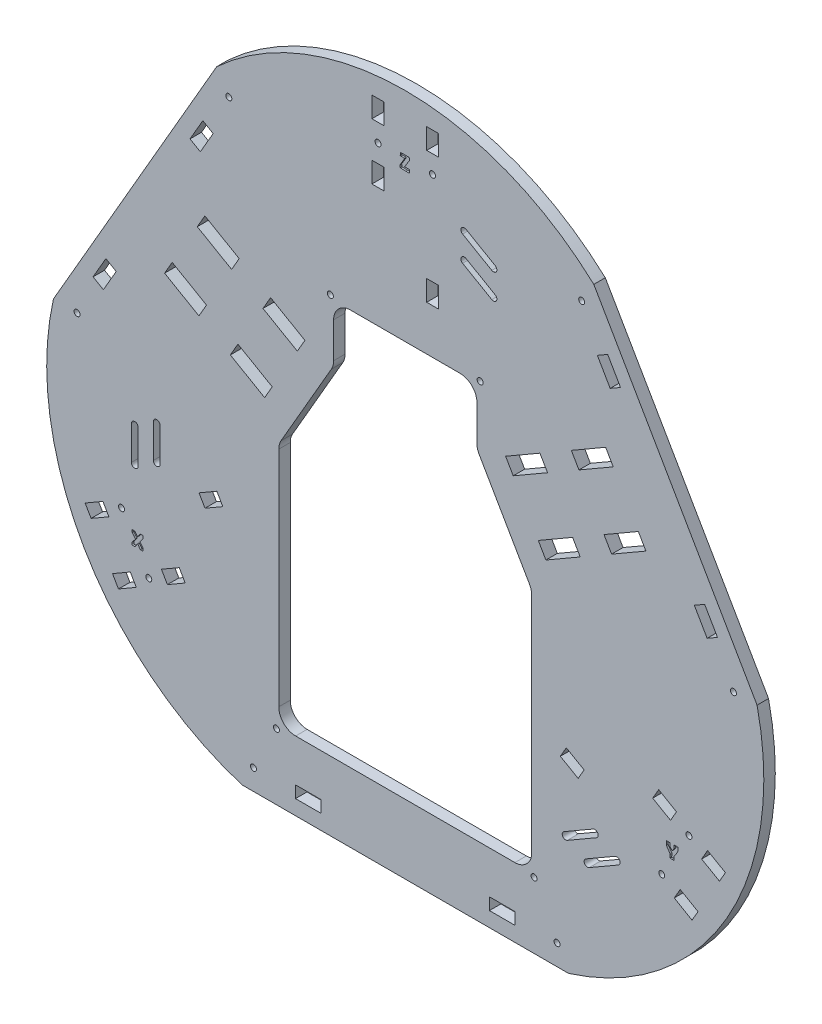
from build123d import *

# Parameters (mm, degrees)
SKETCH1_R                = 3.5
BOSS_EXTRUDE1_DEPTH      = 6.8
SKETCH2_R                = 1.775
SKETCH2_W                = 15.2
SKETCH2_H                = 7.08
CUT_EXTRUDE1_DEPTH       = 6.8
CIRPATTERN1_COUNT        = 3
SKETCH14_R               = 1.775
SKETCH14_W               = 7.08
SKETCH14_H               = 12.2
CUT_EXTRUDE12_DEPTH      = 307.036519191
CIRPATTERN2_COUNT        = 3
CUT_EXTRUDE10_DEPTH      = 1
CUT_EXTRUDE14_DEPTH      = 307.036519333
SKETCH17_R               = 1.775
CUT_EXTRUDE15_DEPTH      = 307.036519333
FILLET5_R                = 10
CUT_EXTRUDE16_DEPTH      = 12.5
LPATTERN1_COUNT          = 2
LPATTERN1_PITCH          = 45
CUT_EXTRUDE17_DEPTH      = 10
LPATTERN2_COUNT          = 2
LPATTERN2_PITCH          = 15
CIRPATTERN5_COPY_1_DEPTH = 10
CIRPATTERN5_COPY_2_DEPTH = 10
CIRPATTERN5_COPY_3_DEPTH = 10
CIRPATTERN5_COPY_4_DEPTH = 10
MIRROR6_COPY_1_DEPTH     = 12.5
MIRROR6_COPY_2_DEPTH     = 12.5


with BuildPart() as part:
    # Sketch1 → Boss-Extrude1 (new body)
    with BuildSketch(Plane.XY):
        with BuildLine():
            Line((-96.81218614, -185), (96.81218614, -185))
            ThreePointArc((96.81218614, -185), (190.525588833, -110), (208.62079277, 8.658187407))
            Line((208.62079277, 8.658187407), (111.80860663, 176.341812593))
            ThreePointArc((111.80860663, 176.341812593), (0, 220), (-111.80860663, 176.341812593))
            Line((-111.80860663, 176.341812593), (-208.62079277, 8.658187407))
            ThreePointArc((-208.62079277, 8.658187407), (-190.525588833, -110), (-96.81218614, -185))
        make_face()
        Circle(SKETCH1_R, mode=Mode.SUBTRACT)
    extrude(amount=BOSS_EXTRUDE1_DEPTH)

    # Sketch2 → Cut-Extrude1 (cut)
    with BuildSketch(Plane.XY.offset(6.8)):
        with Locations((-90, -172.76)):
            Circle(SKETCH2_R)
        with Locations((90, -172.76)):
            Circle(SKETCH2_R)
        with Locations((-57.5, -172.66)):
            Rectangle(SKETCH2_W, SKETCH2_H)
        with Locations((57.5, -172.66)):
            Rectangle(SKETCH2_W, SKETCH2_H)
    cut_extrude1 = extrude(amount=-CUT_EXTRUDE1_DEPTH, mode=Mode.SUBTRACT)

    # CirPattern1: Cut-Extrude1 ×3 about axis
    cirpattern1_axis = Axis((0, 0, 6.8), (0, 0, 1))
    for i in range(1, CIRPATTERN1_COUNT):
        add(cut_extrude1.rotate(cirpattern1_axis, i * 360 / CIRPATTERN1_COUNT), mode=Mode.SUBTRACT)

    # Sketch14 → Cut-Extrude12 (cut, through all)
    with BuildSketch(Plane.XY.offset(6.8)):
        with Locations((-16.14, 184.95)):
            Circle(SKETCH14_R)
        with Locations((16.14, 184.95)):
            Circle(SKETCH14_R)
        with Locations((-16.24, 201.7)):
            Rectangle(SKETCH14_W, SKETCH14_H)
        with Locations((-16.24, 168.2)):
            Rectangle(SKETCH14_W, SKETCH14_H)
        with Locations((16.24, 201.7)):
            Rectangle(SKETCH14_W, SKETCH14_H)
        with Locations((16.24, 123.7)):
            Rectangle(SKETCH14_W, SKETCH14_H)
    cut_extrude12 = extrude(amount=-CUT_EXTRUDE12_DEPTH, mode=Mode.SUBTRACT)

    # CirPattern2: Cut-Extrude12 ×3 about axis
    cirpattern2_axis = Axis((0, 0, 6.8), (0, 0, -1))
    for i in range(1, CIRPATTERN2_COUNT):
        add(cut_extrude12.rotate(cirpattern2_axis, i * 360 / CIRPATTERN2_COUNT), mode=Mode.SUBTRACT)

    # Sketch12 → Cut-Extrude10 (cut)
    with BuildSketch(Plane.XY.offset(6.8)):
        with BuildLine():
            Line((-157.066572257, -86.382099123), (-155.709655893, -86.382099123))
            add(Edge.make_bspline(
                [(-155.709655893, -86.382099123), (-155.536312863, -86.382099123), (-155.536312863, -86.488416698)],
                knots=[0, 0, 0, 1, 1, 1], degree=2))
            Line((-155.536312863, -86.488416698), (-155.536312863, -87.913173062))
            add(Edge.make_bspline(
                [(-155.536312863, -87.913173062), (-155.536312863, -88.050520941), (-157.368148015, -90.320038517), (-157.368148015, -90.364722153)],
                knots=[0, 0, 0, 1, 2, 2, 2], degree=2))
            add(Edge.make_bspline(
                [(-157.368148015, -90.364722153), (-157.368148015, -90.471039729), (-156.534557712, -91.524712456)],
                knots=[0, 0, 0, 1, 1, 1], degree=2))
            add(Edge.make_bspline(
                [(-156.534557712, -91.524712456), (-155.56361953, -92.736833668), (-155.536312863, -92.774070032)],
                knots=[0, 0, 0, 1, 1, 1], degree=2))
            add(Edge.make_bspline(
                [(-155.536312863, -92.774070032), (-155.442407409, -92.894040941), (-155.442407409, -93.608901547)],
                knots=[0, 0, 0, 1, 1, 1], degree=2))
            add(Edge.make_bspline(
                [(-155.442407409, -93.608901547), (-155.442407409, -94.124780335), (-155.475920136, -94.231097911)],
                knots=[0, 0, 0, 1, 1, 1], degree=2))
            add(Edge.make_bspline(
                [(-155.475920136, -94.231097911), (-155.558654681, -94.352310032), (-155.849486196, -94.352310032)],
                knots=[0, 0, 0, 1, 1, 1], degree=2))
            add(Edge.make_bspline(
                [(-155.849486196, -94.352310032), (-155.924773469, -94.352310032), (-156.079498318, -94.352310032)],
                knots=[0, 0, 0, 1, 1, 1], degree=2))
            add(Edge.make_bspline(
                [(-156.079498318, -94.352310032), (-156.272274075, -94.348586395), (-156.506009833, -94.348586395), (-156.926741954, -94.33369185), (-157.041748015, -94.33369185)],
                knots=[0, 0, 0, 1, 2, 3, 3, 3], degree=2))
            add(Edge.make_bspline(
                [(-157.041748015, -94.33369185), (-157.145583166, -94.33369185), (-158.687828015, -92.174215486), (-158.707687409, -92.17049185)],
                knots=[0, 0, 0, 1, 2, 2, 2], degree=2))
            add(Edge.make_bspline(
                [(-158.707687409, -92.17049185), (-158.830140742, -92.276809426), (-159.556172257, -93.354065183)],
                knots=[0, 0, 0, 1, 1, 1], degree=2))
            add(Edge.make_bspline(
                [(-159.556172257, -93.354065183), (-160.262344378, -94.359757305), (-160.33929953, -94.382099123)],
                knots=[0, 0, 0, 1, 1, 1], degree=2))
            add(Edge.make_bspline(
                [(-160.33929953, -94.382099123), (-160.431963772, -94.438768214), (-160.779464378, -94.438768214)],
                knots=[0, 0, 0, 1, 1, 1], degree=2))
            add(Edge.make_bspline(
                [(-160.779464378, -94.438768214), (-161.901403772, -94.438768214), (-161.901403772, -94.197585183), (-161.961796499, -93.738802153), (-161.961796499, -93.626278517)],
                knots=[0, 0, 0, 1, 2, 3, 3, 3], degree=2))
            add(Edge.make_bspline(
                [(-161.961796499, -93.626278517), (-161.961796499, -92.911417911), (-161.864167409, -92.787723365)],
                knots=[0, 0, 0, 1, 1, 1], degree=2))
            add(Edge.make_bspline(
                [(-161.864167409, -92.787723365), (-161.860443772, -92.783999729), (-160.879575893, -91.548295486)],
                knots=[0, 0, 0, 1, 1, 1], degree=2))
            add(Edge.make_bspline(
                [(-160.879575893, -91.548295486), (-160.062121348, -90.553774274), (-160.062121348, -90.375893062)],
                knots=[0, 0, 0, 1, 1, 1], degree=2))
            add(Edge.make_bspline(
                [(-160.062121348, -90.375893062), (-160.062121348, -90.241027608), (-160.875852257, -89.263883365)],
                knots=[0, 0, 0, 1, 1, 1], degree=2))
            add(Edge.make_bspline(
                [(-160.875852257, -89.263883365), (-161.371871651, -88.656581547), (-161.864167409, -88.046797305)],
                knots=[0, 0, 0, 1, 1, 1], degree=2))
            add(Edge.make_bspline(
                [(-161.864167409, -88.046797305), (-161.897680136, -87.957856698), (-161.905127409, -87.806855486)],
                knots=[0, 0, 0, 1, 1, 1], degree=2))
            add(Edge.make_bspline(
                [(-161.905127409, -87.806855486), (-161.908851045, -87.688125789), (-161.905127409, -87.473008214)],
                knots=[0, 0, 0, 1, 1, 1], degree=2))
            add(Edge.make_bspline(
                [(-161.905127409, -87.473008214), (-161.893956499, -87.273599729), (-161.893956499, -87.214448214)],
                knots=[0, 0, 0, 1, 1, 1], degree=2))
            add(Edge.make_bspline(
                [(-161.893956499, -87.214448214), (-161.893956499, -87.099442153), (-161.961796499, -86.667539123), (-161.961796499, -86.552533062)],
                knots=[0, 0, 0, 1, 2, 2, 2], degree=2))
            add(Edge.make_bspline(
                [(-161.961796499, -86.552533062), (-161.961796499, -86.441250638), (-161.75040256, -86.441250638)],
                knots=[0, 0, 0, 1, 1, 1], degree=2))
            add(Edge.make_bspline(
                [(-161.75040256, -86.441250638), (-161.626708015, -86.441250638), (-161.136894681, -86.463592456), (-161.016923772, -86.463592456)],
                knots=[0, 0, 0, 1, 2, 2, 2], degree=2))
            add(Edge.make_bspline(
                [(-161.016923772, -86.463592456), (-160.903158924, -86.463592456), (-160.456788015, -86.448697911), (-160.388521348, -86.448697911)],
                knots=[0, 0, 0, 1, 2, 2, 2], degree=2))
            add(Edge.make_bspline(
                [(-160.388521348, -86.448697911), (-160.284686196, -86.448697911), (-158.746164984, -88.611897911), (-158.722581954, -88.611897911)],
                knots=[0, 0, 0, 1, 2, 2, 2], degree=2))
            add(Edge.make_bspline(
                [(-158.722581954, -88.611897911), (-158.606334681, -88.525439729), (-157.879061954, -87.440736698)],
                knots=[0, 0, 0, 1, 1, 1], degree=2))
            add(Edge.make_bspline(
                [(-157.879061954, -87.440736698), (-157.175372257, -86.382099123), (-157.066572257, -86.382099123)],
                knots=[0, 0, 0, 1, 1, 1], degree=2))
        make_face()
        with BuildLine():
            Line((159.33519656, -87.81991), (159.46757959, -87.81991))
            add(Edge.make_bspline(
                [(159.46757959, -87.81991), (159.81135656, -87.81991), (161.144689893, -87.737175455), (161.492190499, -87.737175455)],
                knots=[0, 0, 0, 1, 2, 2, 2], degree=2))
            add(Edge.make_bspline(
                [(161.492190499, -87.737175455), (161.605955348, -87.737175455), (161.605955348, -88.022615455)],
                knots=[0, 0, 0, 1, 1, 1], degree=2))
            add(Edge.make_bspline(
                [(161.605955348, -88.022615455), (161.605955348, -88.303517273), (161.605955348, -89.513156061), (161.605955348, -89.797781515)],
                knots=[0, 0, 0, 1, 2, 2, 2], degree=2))
            add(Edge.make_bspline(
                [(161.605955348, -89.797781515), (161.605955348, -90.083221515), (161.504602621, -90.244152424)],
                knots=[0, 0, 0, 1, 1, 1], degree=2))
            add(Edge.make_bspline(
                [(161.504602621, -90.244152424), (160.766158984, -91.708627576), (159.463855954, -93.358431212)],
                knots=[0, 0, 0, 1, 1, 1], degree=2))
            add(Edge.make_bspline(
                [(159.463855954, -93.358431212), (159.302925045, -93.59837303), (159.302925045, -93.766751212)],
                knots=[0, 0, 0, 1, 1, 1], degree=2))
            add(Edge.make_bspline(
                [(159.302925045, -93.766751212), (159.302925045, -94.089427576), (159.424137166, -95.295342727), (159.424137166, -95.572520909)],
                knots=[0, 0, 0, 1, 2, 2, 2], degree=2))
            add(Edge.make_bspline(
                [(159.424137166, -95.572520909), (159.424137166, -95.681320909), (159.35257353, -95.696215455)],
                knots=[0, 0, 0, 1, 1, 1], degree=2))
            add(Edge.make_bspline(
                [(159.35257353, -95.696215455), (159.345126257, -95.699939091), (159.210260802, -95.714833636)],
                knots=[0, 0, 0, 1, 1, 1], degree=2))
            add(Edge.make_bspline(
                [(159.210260802, -95.714833636), (158.993902014, -95.737175455), (158.166517772, -95.737175455)],
                knots=[0, 0, 0, 1, 1, 1], degree=2))
            add(Edge.make_bspline(
                [(158.166517772, -95.737175455), (157.377184439, -95.737175455), (157.145931105, -95.714833636)],
                knots=[0, 0, 0, 1, 1, 1], degree=2))
            add(Edge.make_bspline(
                [(157.145931105, -95.714833636), (156.999894742, -95.699939091), (156.999894742, -95.565073636)],
                knots=[0, 0, 0, 1, 1, 1], degree=2))
            add(Edge.make_bspline(
                [(156.999894742, -95.565073636), (156.999894742, -95.242397273), (157.121106863, -94.017863939), (157.121106863, -93.733238485)],
                knots=[0, 0, 0, 1, 2, 2, 2], degree=2))
            add(Edge.make_bspline(
                [(157.121106863, -93.733238485), (157.121106863, -93.53053303), (156.945708075, -93.309209394)],
                knots=[0, 0, 0, 1, 1, 1], degree=2))
            add(Edge.make_bspline(
                [(156.945708075, -93.309209394), (156.229606257, -92.338271212), (154.947977166, -90.356676061)],
                knots=[0, 0, 0, 1, 1, 1], degree=2))
            add(Edge.make_bspline(
                [(154.947977166, -90.356676061), (154.81807656, -90.127905152), (154.81807656, -89.993039697)],
                knots=[0, 0, 0, 1, 1, 1], degree=2))
            add(Edge.make_bspline(
                [(154.81807656, -89.993039697), (154.81807656, -89.644297879), (154.81807656, -88.292346364), (154.81807656, -87.943604545)],
                knots=[0, 0, 0, 1, 2, 2, 2], degree=2))
            add(Edge.make_bspline(
                [(154.81807656, -87.943604545), (154.81807656, -87.737175455), (154.887584439, -87.737175455)],
                knots=[0, 0, 0, 1, 1, 1], degree=2))
            add(Edge.make_bspline(
                [(154.887584439, -87.737175455), (155.222672924, -87.737175455), (156.538629287, -87.816186364), (156.878682621, -87.816186364)],
                knots=[0, 0, 0, 1, 2, 2, 2], degree=2))
            add(Edge.make_bspline(
                [(156.878682621, -87.816186364), (156.999894742, -87.816186364), (156.999894742, -87.913815455)],
                knots=[0, 0, 0, 1, 1, 1], degree=2))
            add(Edge.make_bspline(
                [(156.999894742, -87.913815455), (156.999894742, -88.18727), (156.999894742, -89.367119697), (156.999894742, -89.640574242)],
                knots=[0, 0, 0, 1, 2, 2, 2], degree=2))
            add(Edge.make_bspline(
                [(156.999894742, -89.640574242), (156.999894742, -89.796540303), (157.510808681, -90.501471212)],
                knots=[0, 0, 0, 1, 1, 1], degree=2))
            add(Edge.make_bspline(
                [(157.510808681, -90.501471212), (157.910440196, -91.066571818), (158.212015954, -91.34375)],
                knots=[0, 0, 0, 1, 1, 1], degree=2))
            add(Edge.make_bspline(
                [(158.212015954, -91.34375), (158.463128681, -91.077742727), (158.865242621, -90.505194848)],
                knots=[0, 0, 0, 1, 1, 1], degree=2))
            add(Edge.make_bspline(
                [(158.865242621, -90.505194848), (159.424137166, -89.840797273), (159.424137166, -89.662916061)],
                knots=[0, 0, 0, 1, 1, 1], degree=2))
            add(Edge.make_bspline(
                [(159.424137166, -89.662916061), (159.424137166, -89.393185152), (159.302925045, -88.220782727), (159.302925045, -87.951051818)],
                knots=[0, 0, 0, 1, 2, 2, 2], degree=2))
            add(Edge.make_bspline(
                [(159.302925045, -87.951051818), (159.302925045, -87.831080909), (159.33519656, -87.81991)],
                knots=[0, 0, 0, 1, 1, 1], degree=2))
        make_face()
        with BuildLine():
            add(Edge.make_bspline(
                [(2.273089288, 178.670583363), (1.919382621, 178.670583363), (0.543848075, 178.730161545), (0.190141409, 178.730161545)],
                knots=[0, 0, 0, 1, 2, 2, 2], degree=2))
            add(Edge.make_bspline(
                [(0.190141409, 178.730161545), (-0.302154349, 178.730161545), (-2.266372531, 178.791795484), (-2.758668288, 178.791795484)],
                knots=[0, 0, 0, 1, 2, 2, 2], degree=2))
            add(Edge.make_bspline(
                [(-2.758668288, 178.791795484), (-2.981233137, 178.791795484), (-3.001092531, 178.917972454)],
                knots=[0, 0, 0, 1, 1, 1], degree=2))
            add(Edge.make_bspline(
                [(-3.001092531, 178.917972454), (-3.047831925, 179.280367605), (-3.092515561, 179.954694878)],
                knots=[0, 0, 0, 1, 1, 1], degree=2))
            add(Edge.make_bspline(
                [(-3.092515561, 179.954694878), (-3.122304652, 180.261235484), (-3.122304652, 180.283577302)],
                knots=[0, 0, 0, 1, 1, 1], degree=2))
            add(Edge.make_bspline(
                [(-3.122304652, 180.283577302), (-3.122304652, 180.302195484), (-0.414677985, 184.743601545), (-0.414677985, 184.894602757)],
                knots=[0, 0, 0, 1, 2, 2, 2], degree=2))
            add(Edge.make_bspline(
                [(-0.414677985, 184.894602757), (-0.414677985, 184.973613666), (-0.550784652, 184.973613666)],
                knots=[0, 0, 0, 1, 1, 1], degree=2))
            add(Edge.make_bspline(
                [(-0.550784652, 184.973613666), (-0.929315561, 184.973613666), (-2.497625864, 184.973613666), (-2.879880409, 184.973613666)],
                knots=[0, 0, 0, 1, 2, 2, 2], degree=2))
            add(Edge.make_bspline(
                [(-2.879880409, 184.973613666), (-3.001092531, 184.973613666), (-3.001092531, 185.099790636)],
                knots=[0, 0, 0, 1, 1, 1], degree=2))
            add(Edge.make_bspline(
                [(-3.001092531, 185.099790636), (-3.001092531, 185.276857302), (-2.758668288, 186.476566393), (-2.758668288, 186.735126393)],
                knots=[0, 0, 0, 1, 2, 2, 2], degree=2))
            add(Edge.make_bspline(
                [(-2.758668288, 186.735126393), (-2.758668288, 186.83647912), (-2.615114349, 186.83647912)],
                knots=[0, 0, 0, 1, 1, 1], degree=2))
            add(Edge.make_bspline(
                [(-2.615114349, 186.83647912), (-1.840675561, 186.83647912), (1.383644439, 186.791795484), (2.158083227, 186.791795484)],
                knots=[0, 0, 0, 1, 2, 2, 2], degree=2))
            add(Edge.make_bspline(
                [(2.158083227, 186.791795484), (2.279295348, 186.791795484), (2.343411712, 186.621361545)],
                knots=[0, 0, 0, 1, 1, 1], degree=2))
            add(Edge.make_bspline(
                [(2.343411712, 186.621361545), (2.453452924, 186.196905787), (2.453452924, 185.344697302)],
                knots=[0, 0, 0, 1, 1, 1], degree=2))
            add(Edge.make_bspline(
                [(2.453452924, 185.344697302), (2.453452924, 185.233414878), (2.345894136, 185.046845181)],
                knots=[0, 0, 0, 1, 1, 1], degree=2))
            add(Edge.make_bspline(
                [(2.345894136, 185.046845181), (1.992187469, 184.530966393), (0.883901409, 182.710302151)],
                knots=[0, 0, 0, 1, 1, 1], degree=2))
            add(Edge.make_bspline(
                [(0.883901409, 182.710302151), (-0.259386684, 180.879279185), (-0.392244222, 180.582489176)],
                knots=[0, 0, 0, 0.883793474, 0.883793474, 0.883793474], degree=2))
            add(Edge.make_bspline(
                [(-0.392244222, 180.582489176), (-0.36712338, 180.609977302), (-0.305877985, 180.609977302)],
                knots=[0.410167044, 0.410167044, 0.410167044, 1, 1, 1], degree=2))
            add(Edge.make_bspline(
                [(-0.305877985, 180.609977302), (0.809855348, 180.609977302), (1.417157166, 180.631077908)],
                knots=[0, 0, 0, 1, 1, 1], degree=2))
            add(Edge.make_bspline(
                [(1.417157166, 180.631077908), (1.538369288, 180.633560332), (1.976051712, 180.663349423)],
                knots=[0, 0, 0, 1, 1, 1], degree=2))
            add(Edge.make_bspline(
                [(1.976051712, 180.663349423), (2.289225045, 180.731189423), (2.482000803, 180.731189423)],
                knots=[0, 0, 0, 1, 1, 1], degree=2))
            add(Edge.make_bspline(
                [(2.482000803, 180.731189423), (2.574665045, 180.731189423), (2.574665045, 180.612459726)],
                knots=[0, 0, 0, 1, 1, 1], degree=2))
            add(Edge.make_bspline(
                [(2.574665045, 180.612459726), (2.574665045, 179.67999912), (2.453452924, 178.793036696)],
                knots=[0, 0, 0, 1, 1, 1], degree=2))
            add(Edge.make_bspline(
                [(2.453452924, 178.793036696), (2.396783833, 178.670583363), (2.273089288, 178.670583363)],
                knots=[0, 0, 0, 1, 1, 1], degree=2))
        make_face()
    extrude(amount=-CUT_EXTRUDE10_DEPTH, mode=Mode.SUBTRACT)

    # Sketch16 → Cut-Extrude14 (cut, through all)
    with BuildSketch(Plane.XY.offset(6.8)):
        Polygon((-75, 1), (-42.5, 57.291651246), (-42.5, 91), (42.5, 91), (42.5, 57.291651246), (75, 1), (75, -144), (-75, -144), align=None)
    extrude(amount=-CUT_EXTRUDE14_DEPTH, mode=Mode.SUBTRACT)

    # Sketch17 → Cut-Extrude15 (cut, through all)
    with BuildSketch(Plane.XY.offset(6.8)):
        with Locations((76.4, -145.9)):
            Circle(SKETCH17_R)
        with Locations((-76.4, -145.9)):
            Circle(SKETCH17_R)
        with Locations((-44.4, 92.9)):
            Circle(SKETCH17_R)
        with Locations((44.4, 92.9)):
            Circle(SKETCH17_R)
    extrude(amount=-CUT_EXTRUDE15_DEPTH, mode=Mode.SUBTRACT)

    # Fillet5
    fillet5_edges = [part.edges().sort_by_distance(p)[0] for p in [
        (-75, -144, 3.4),
        (75, -144, 3.4),
        (75, 1, 3.4),
        (-75, 1, 3.4),
        (-42.5, 91, 3.4),
        (42.5, 91, 3.4),
        (42.5, 57.291651246, 3.4),
        (-42.5, 57.291651246, 3.4),
    ]]
    fillet(fillet5_edges, radius=FILLET5_R)

    # Sketch19 → Cut-Extrude16 (cut)
    with BuildSketch(Plane.XY.offset(6.8)):
        Polygon((-138.207335971, 62.617872119), (-142.707335971, 54.823643485), (-122.355738983, 43.073643485), (-117.855738983, 50.867872119), align=None)
        Polygon((-98.480738983, 84.426356515), (-102.980738983, 76.632127881), (-123.332335971, 88.382127881), (-118.832335971, 96.176356515), align=None)
    cut_extrude16 = extrude(amount=-CUT_EXTRUDE16_DEPTH, mode=Mode.SUBTRACT)

    # LPattern1: Cut-Extrude16 ×2
    with Locations(*[Vector(0.8660254037844383, -0.5000000000000007, 0) * (i * LPATTERN1_PITCH) for i in range(1, LPATTERN1_COUNT)]):
        add(cut_extrude16, mode=Mode.SUBTRACT)

    # Sketch21 → Cut-Extrude17 (cut)
    with BuildSketch(Plane.XY.offset(6.8)):
        with BuildLine():
            Line((51.320508076, 153.267949192), (34, 163.267949192))
            ThreePointArc((34, 163.267949192), (33.267949192, 166), (36, 166.732050808))
            Line((36, 166.732050808), (53.320508076, 156.732050808))
            ThreePointArc((53.320508076, 156.732050808), (54.052558883, 154), (51.320508076, 153.267949192))
        make_face()
    cut_extrude17 = extrude(amount=-CUT_EXTRUDE17_DEPTH, mode=Mode.SUBTRACT)

    # LPattern2: Cut-Extrude17 ×2
    with Locations(*[(0, -i * LPATTERN2_PITCH, 0) for i in range(1, LPATTERN2_COUNT)]):
        add(cut_extrude17, mode=Mode.SUBTRACT)

    # CirPattern5 copy 1 sketch → CirPattern5 copy 1 (cut)
    with BuildSketch(Plane(origin=(12.990381057, 7.5, 6.8), x_dir=(-0.4999999999999998, 0.8660254037844387, 0), z_dir=(0, 0, 1))):
        with BuildLine():
            Line((51.320508076, 153.267949192), (34, 163.267949192))
            ThreePointArc((34, 163.267949192), (33.267949192, 166), (36, 166.732050808))
            Line((36, 166.732050808), (53.320508076, 156.732050808))
            ThreePointArc((53.320508076, 156.732050808), (54.052558883, 154), (51.320508076, 153.267949192))
        make_face()
    extrude(amount=-CIRPATTERN5_COPY_1_DEPTH, mode=Mode.SUBTRACT)

    # CirPattern5 copy 2 sketch → CirPattern5 copy 2 (cut)
    with BuildSketch(Plane(origin=(-12.990381057, 7.5, 6.8), x_dir=(-0.5000000000000004, -0.8660254037844384, 0), z_dir=(0, 0, 1))):
        with BuildLine():
            Line((51.320508076, 153.267949192), (34, 163.267949192))
            ThreePointArc((34, 163.267949192), (33.267949192, 166), (36, 166.732050808))
            Line((36, 166.732050808), (53.320508076, 156.732050808))
            ThreePointArc((53.320508076, 156.732050808), (54.052558883, 154), (51.320508076, 153.267949192))
        make_face()
    extrude(amount=-CIRPATTERN5_COPY_2_DEPTH, mode=Mode.SUBTRACT)

    # CirPattern5 copy 3 sketch → CirPattern5 copy 3 (cut)
    with BuildSketch(Plane(origin=(0, 0, 6.8), x_dir=(-0.4999999999999998, 0.8660254037844387, 0), z_dir=(0, 0, 1))):
        with BuildLine():
            Line((51.320508076, 153.267949192), (34, 163.267949192))
            ThreePointArc((34, 163.267949192), (33.267949192, 166), (36, 166.732050808))
            Line((36, 166.732050808), (53.320508076, 156.732050808))
            ThreePointArc((53.320508076, 156.732050808), (54.052558883, 154), (51.320508076, 153.267949192))
        make_face()
    extrude(amount=-CIRPATTERN5_COPY_3_DEPTH, mode=Mode.SUBTRACT)

    # CirPattern5 copy 4 sketch → CirPattern5 copy 4 (cut)
    with BuildSketch(Plane(origin=(0, 0, 6.8), x_dir=(-0.5000000000000004, -0.8660254037844384, 0), z_dir=(0, 0, 1))):
        with BuildLine():
            Line((51.320508076, 153.267949192), (34, 163.267949192))
            ThreePointArc((34, 163.267949192), (33.267949192, 166), (36, 166.732050808))
            Line((36, 166.732050808), (53.320508076, 156.732050808))
            ThreePointArc((53.320508076, 156.732050808), (54.052558883, 154), (51.320508076, 153.267949192))
        make_face()
    extrude(amount=-CIRPATTERN5_COPY_4_DEPTH, mode=Mode.SUBTRACT)

    # Mirror6 copy 1 sketch → Mirror6 copy 1 (cut)
    with BuildSketch(Plane(origin=(-38.97114317, -22.5, 6.8), x_dir=(-1, 0, 0), z_dir=(0, 0, 1))):
        Polygon((-138.207335971, -62.617872119), (-142.707335971, -54.823643485), (-122.355738983, -43.073643485), (-117.855738983, -50.867872119), align=None)
        Polygon((-98.480738983, -84.426356515), (-102.980738983, -76.632127881), (-123.332335971, -88.382127881), (-118.832335971, -96.176356515), align=None)
    extrude(amount=-MIRROR6_COPY_1_DEPTH, mode=Mode.SUBTRACT)

    # Mirror6 copy 2 sketch → Mirror6 copy 2 (cut)
    with BuildSketch(Plane(origin=(0, 0, 6.8), x_dir=(-1, 0, 0), z_dir=(0, 0, 1))):
        Polygon((-138.207335971, -62.617872119), (-142.707335971, -54.823643485), (-122.355738983, -43.073643485), (-117.855738983, -50.867872119), align=None)
        Polygon((-98.480738983, -84.426356515), (-102.980738983, -76.632127881), (-123.332335971, -88.382127881), (-118.832335971, -96.176356515), align=None)
    extrude(amount=-MIRROR6_COPY_2_DEPTH, mode=Mode.SUBTRACT)


solid = part.part
